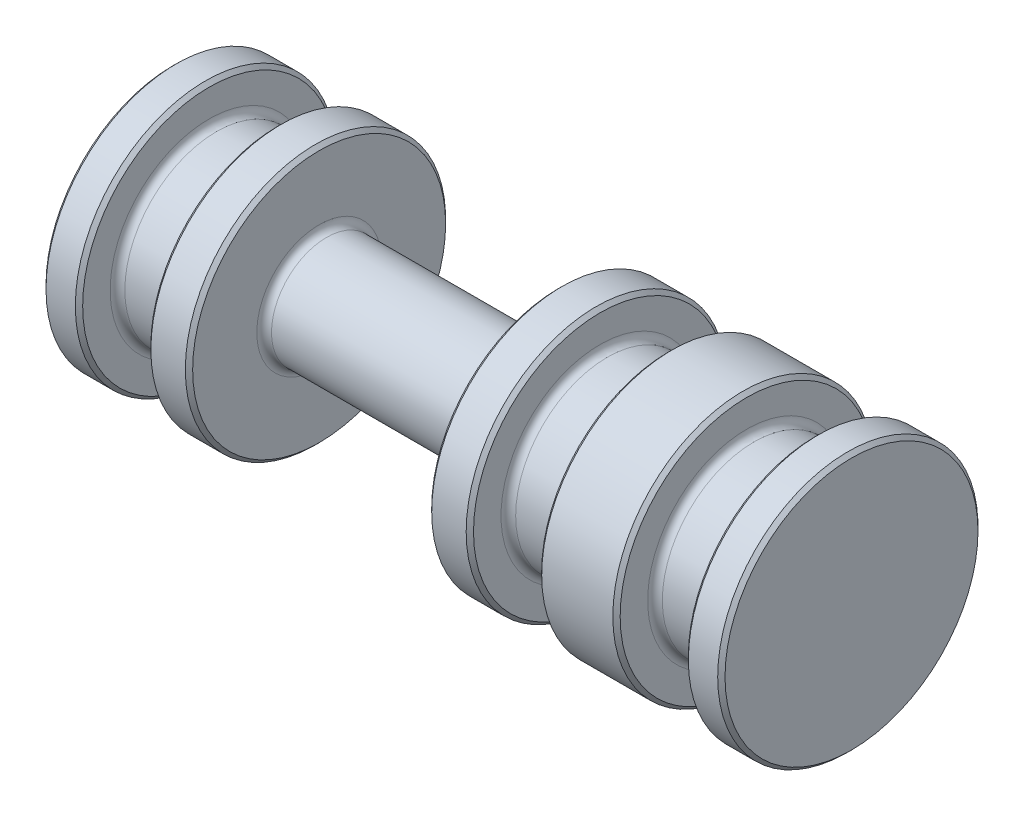
from build123d import *

# Parameters (mm, degrees)
SKETCH1_R           = 4.5085
BOSS_EXTRUDE1_DEPTH = 23.5204
SKETCH2_W           = 2.3622
SKETCH2_H           = 1.3335
SKETCH2_W_2         = 8.2804
SKETCH2_H_2         = 2.6035
FILLET1_R           = 0.254
CHAMFER1_SIZE       = 0.127
CHAMFER2_SIZE       = 0.127


with BuildPart() as part:
    # Sketch1 → Boss-Extrude1 (new body)
    with BuildSketch(Plane(origin=(0, 0, 0), x_dir=(0, 0, -1), z_dir=(1, 0, 0))):
        Circle(SKETCH1_R)
    extrude(amount=BOSS_EXTRUDE1_DEPTH)

    # Sketch2 → Cut-Revolve1 (revolve, cut)
    with BuildSketch(Plane.XY):
        with Locations((2.4511, 3.84175)):
            Rectangle(SKETCH2_W, SKETCH2_H)
        with Locations((21.0693, 3.84175)):
            Rectangle(SKETCH2_W, SKETCH2_H)
        with Locations((15.9893, 3.84175)):
            Rectangle(SKETCH2_W, SKETCH2_H)
        with Locations((9.2202, 3.20675)):
            Rectangle(SKETCH2_W_2, SKETCH2_H_2)
    revolve(axis=Axis((-1.617419624, 0, 0), (1, 0, 0)), mode=Mode.SUBTRACT)

    # Fillet1
    fillet1_edges = [part.edges().sort_by_distance(p)[0] for p in [
        (22.2504, -3.175, 0),
        (19.8882, -3.175, 0),
        (17.1704, -3.175, 0),
        (14.8082, -3.175, 0),
        (13.3604, -1.905, 0),
        (5.08, -1.905, 0),
        (3.6322, -3.175, 0),
        (1.27, -3.175, 0),
    ]]
    fillet(fillet1_edges, radius=FILLET1_R)

    # Chamfer1
    chamfer1_edges = [part.edges().sort_by_distance(p)[0] for p in [
        (13.3604, 0, 4.5085),
        (0, 0, 4.5085),
        (22.2504, 0, 4.5085),
        (17.1704, 0, 4.5085),
        (3.6322, 0, 4.5085),
    ]]
    chamfer(chamfer1_edges, length=CHAMFER1_SIZE)

    # Chamfer2
    chamfer2_edges = [part.edges().sort_by_distance(p)[0] for p in [
        (23.5204, 0, 4.5085),
        (19.8882, 0, 4.5085),
        (14.8082, 0, 4.5085),
        (5.08, 0, 4.5085),
        (1.27, 0, 4.5085),
    ]]
    chamfer(chamfer2_edges, length=CHAMFER2_SIZE)


solid = part.part
